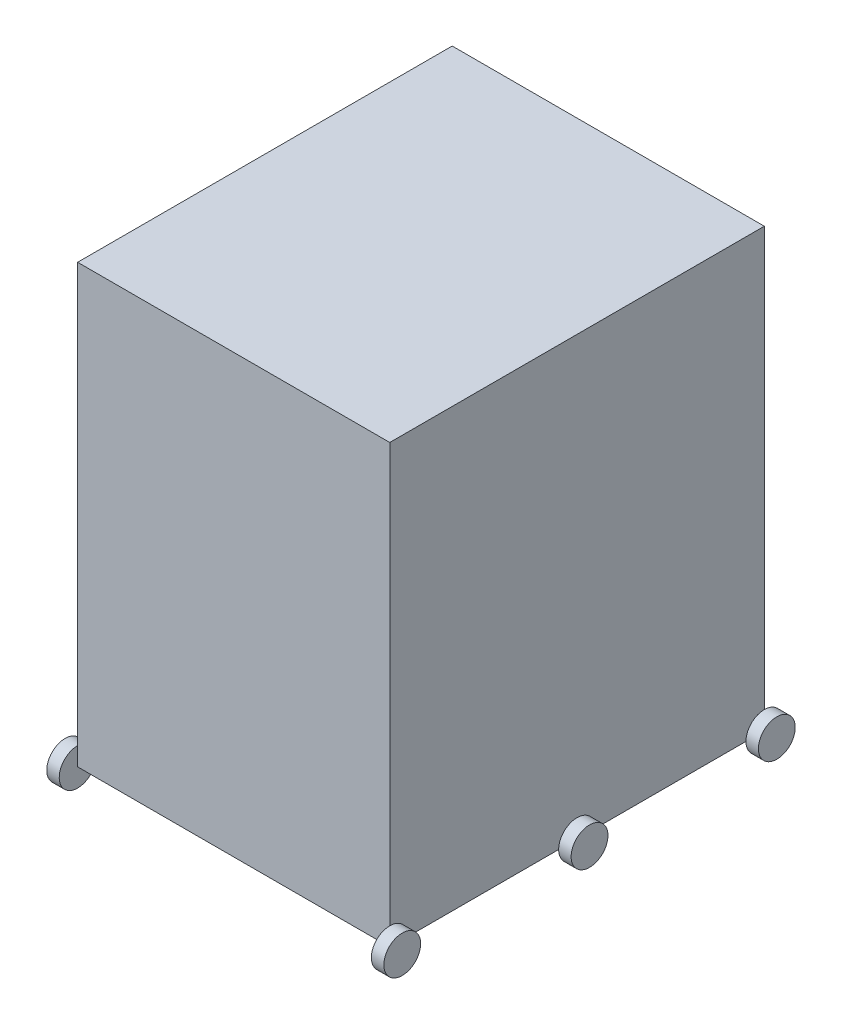
from build123d import *

# Parameters (mm, degrees)
SKETCH1_W           = 250
SKETCH1_H           = 300
BOSS_EXTRUDE1_DEPTH = 350
SKETCH2_R           = 14.75
BOSS_EXTRUDE2_DEPTH = 10
LPATTERN2_COUNT     = 2
LPATTERN2_PITCH     = 260


with BuildPart() as part:
    # Sketch1 → Boss-Extrude1 (new body)
    with BuildSketch(Plane(origin=(0, 0, 0), x_dir=(1, 0, 0), z_dir=(0, 1, 0))):
        with Locations((-29.444356891, 74.84242821)):
            Rectangle(SKETCH1_W, SKETCH1_H)
    extrude(amount=BOSS_EXTRUDE1_DEPTH)

    # Sketch2 → Boss-Extrude2 (add)
    with BuildSketch(Plane(origin=(95.555643109, 0, 0), x_dir=(0, 0, -1), z_dir=(1, 0, 0))):
        with Locations((-75.15757179, 0)):
            Circle(SKETCH2_R)
        with Locations((224.84242821, 0)):
            Circle(SKETCH2_R)
        with Locations((74.84242821, 0)):
            Circle(SKETCH2_R)
    boss_extrude2 = extrude(amount=BOSS_EXTRUDE2_DEPTH)

    # LPattern2: Boss-Extrude2 ×2
    with Locations(*[(-i * LPATTERN2_PITCH, 0, 0) for i in range(1, LPATTERN2_COUNT)]):
        add(boss_extrude2)


solid = part.part
